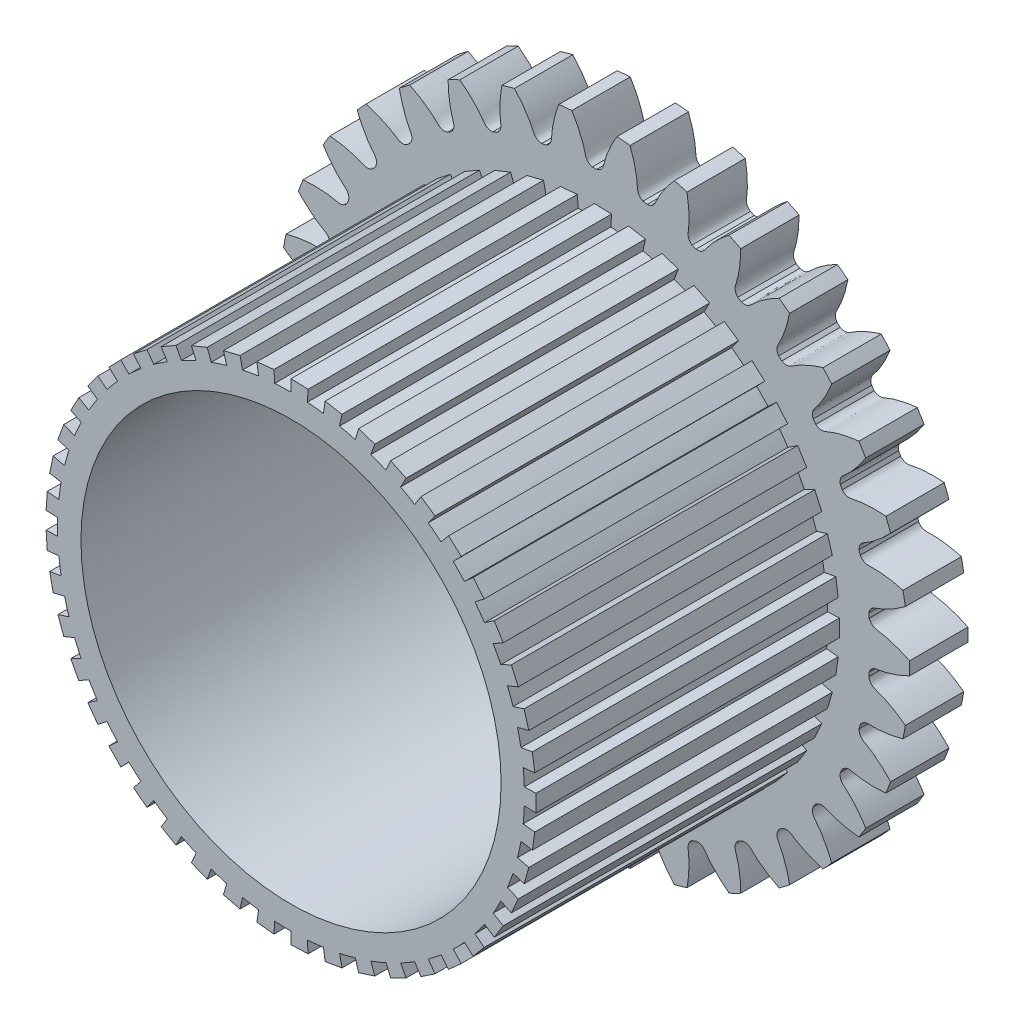
from build123d import *

# Parameters (mm, degrees)
SKETCH_1_R               = 27
EXTRUDE_1_DEPTH          = 5
CUT_EXTRUDE_1_DEPTH      = 39.509739028
PATTERN_CIRCULAR_1_COUNT = 34
SKETCH_4_R               = 12
SKETCH_4_R_2             = 4.5
SKETCH_4_R_3             = 3.25
CUT_EXTRUDE_2_DEPTH      = 3
CHAMFER_1_SIZE           = 2.5
SKETCH_6_R               = 3.25
CUT_EXTRUDE_3_DEPTH      = 39.252654908
SKETCH_7_R               = 18
EXTRUDE_2_DEPTH          = 26
SKETCH_8_R               = 4.5
CUT_EXTRUDE_4_DEPTH      = 2.5


with BuildPart() as part:
    # 草图1 → 凸台-拉伸1 (new body)
    with BuildSketch(Plane.XY):
        Circle(SKETCH_1_R)
    extrude(amount=EXTRUDE_1_DEPTH)

    # 草图2 → 切除-拉伸1 (cut, through all)
    with BuildSketch(Plane.XY):
        with BuildLine():
            ThreePointArc((0.183171175, 23.624289901), (0, 23.625), (-0.183171175, 23.624289901))
            add(Edge.make_bspline(
                [(-0.183171175, 23.624289901), (-0.716587806, 23.775112896), (-0.763410395, 24.188787315), (-0.879946356, 24.623629896), (-0.912930358, 24.738245821), (-0.951084244, 24.861314333), (-0.99469329, 24.992699977), (-1.044123655, 25.132221413), (-1.099711127, 25.279697341), (-1.161793992, 25.434932943), (-1.230702926, 25.597724076), (-1.306763614, 25.76785621), (-1.390295632, 25.945104927), (-1.481612426, 26.129235971), (-1.581020975, 26.320005435), (-1.688821555, 26.51715992), (-1.805307471, 26.720436707), (-1.930764813, 26.929563939), (-2.065472203, 27.144260803), (-2.209700557, 27.364237722), (-2.36371284, 27.589196551), (-2.527763841, 27.818830783), (-2.702099938, 28.052825758), (-2.886958877, 28.290858874), (-3.082569553, 28.532599812), (-3.289151799, 28.777710761), (-3.506916179, 29.025846649), (-3.73606378, 29.276655378), (-3.97678604, 29.52977807), (-4.229264468, 29.784849315), (-4.586391615, 30.131497572), (-4.865591808, 30.386500811), (-5.057363345, 30.554916542)],
                knots=[0, 0, 0, 0, 0.13072362, 0.143503881, 0.157401081, 0.17241522, 0.188546299, 0.205794316, 0.224159273, 0.243641169, 0.264240005, 0.285955779, 0.308788493, 0.332738146, 0.357804738, 0.383988269, 0.411288739, 0.439706149, 0.469240498, 0.499891786, 0.531660014, 0.56454518, 0.598547286, 0.633666331, 0.669902315, 0.707255238, 0.745725101, 0.785311903, 0.826015644, 0.867836324, 0.910773943, 1, 1, 1, 1], degree=3))
            ThreePointArc((-5.057363345, 30.554916542), (0, 30.970628811), (5.057363345, 30.554916542))
            add(Edge.make_bspline(
                [(0.183171175, 23.624289901), (0.716587806, 23.775112896), (0.763410395, 24.188787315), (0.879946356, 24.623629896), (0.912930358, 24.738245821), (0.951084244, 24.861314333), (0.99469329, 24.992699977), (1.044123655, 25.132221413), (1.099711127, 25.279697341), (1.161793992, 25.434932943), (1.230702926, 25.597724076), (1.306763614, 25.76785621), (1.390295632, 25.945104927), (1.481612426, 26.129235971), (1.581020975, 26.320005435), (1.688821555, 26.51715992), (1.805307471, 26.720436707), (1.930764813, 26.929563939), (2.065472203, 27.144260803), (2.209700557, 27.364237722), (2.36371284, 27.589196551), (2.527763841, 27.818830783), (2.702099938, 28.052825758), (2.886958877, 28.290858874), (3.082569553, 28.532599812), (3.289151799, 28.777710761), (3.506916179, 29.025846649), (3.73606378, 29.276655378), (3.97678604, 29.52977807), (4.229264468, 29.784849315), (4.586391615, 30.131497572), (4.865591808, 30.386500811), (5.057363345, 30.554916542)],
                knots=[0, 0, 0, 0, 0.13072362, 0.143503881, 0.157401081, 0.17241522, 0.188546299, 0.205794316, 0.224159273, 0.243641169, 0.264240005, 0.285955779, 0.308788493, 0.332738146, 0.357804738, 0.383988269, 0.411288739, 0.439706149, 0.469240498, 0.499891786, 0.531660014, 0.56454518, 0.598547286, 0.633666331, 0.669902315, 0.707255238, 0.745725101, 0.785311903, 0.826015644, 0.867836324, 0.910773943, 1, 1, 1, 1], degree=3))
        make_face()
    cut_extrude_1 = extrude(amount=CUT_EXTRUDE_1_DEPTH, mode=Mode.SUBTRACT)

    # 阵列(圆周)1: 切除-拉伸1 ×34 about axis
    pattern_circular_1_axis = Axis((0, 0, -1.5), (0, 0, 1))
    for i in range(1, PATTERN_CIRCULAR_1_COUNT):
        add(cut_extrude_1.rotate(pattern_circular_1_axis, i * 360 / PATTERN_CIRCULAR_1_COUNT), mode=Mode.SUBTRACT)

    # 草图4 → 切除-拉伸2 (cut)
    # profile 1 of 2: a face of its own
    with BuildSketch(Plane.XY.offset(5)):
        Circle(SKETCH_4_R)
        Circle(SKETCH_4_R_2, mode=Mode.SUBTRACT)
    # profile 2 of 2: a face of its own
    with BuildSketch(Plane.XY.offset(5)):
        Circle(SKETCH_4_R_3)
    extrude(amount=-CUT_EXTRUDE_2_DEPTH, mode=Mode.SUBTRACT)

    # 倒角1
    chamfer_1_edges = [part.edges().sort_by_distance(p)[0] for p in [
        (-12, 0, 5),
    ]]
    chamfer(chamfer_1_edges, length=CHAMFER_1_SIZE)

    # 草图6 → 切除-拉伸3 (cut, through all)
    with BuildSketch(Plane.XY.offset(2)):
        Circle(SKETCH_6_R)
    extrude(amount=-CUT_EXTRUDE_3_DEPTH, mode=Mode.SUBTRACT)

    # 草图7 → 凸台-拉伸2 (add)
    with BuildSketch(Plane.XY.offset(5)):
        with BuildLine():
            ThreePointArc((2.783462019, 19.805361375), (2.090569265, 19.890437907), (1.395129475, 19.951281005))
            Line((1.395129475, 19.951281005), (1.464885949, 20.948845055))
            Line((1.464885949, 20.948845055), (0, 21))
            Line((0, 21), (0, 20))
            ThreePointArc((0, 20), (-0.697989934, 19.98781654), (-1.395129475, 19.951281005))
            Line((-1.395129475, 19.951281005), (-1.464885949, 20.948845055))
            Line((-1.464885949, 20.948845055), (-2.92263512, 20.795629444))
            Line((-2.92263512, 20.795629444), (-2.783462019, 19.805361375))
            ThreePointArc((-2.783462019, 19.805361375), (-3.472963553, 19.69615506), (-4.158233816, 19.562952015))
            Line((-4.158233816, 19.562952015), (-4.366145507, 20.541099615))
            Line((-4.366145507, 20.541099615), (-5.788384472, 20.186495615))
            Line((-5.788384472, 20.186495615), (-5.512747116, 19.225233919))
            ThreePointArc((-5.512747116, 19.225233919), (-6.180339887, 19.021130326), (-6.840402867, 18.793852416))
            Line((-6.840402867, 18.793852416), (-7.18242301, 19.733545037))
            Line((-7.18242301, 19.733545037), (-8.541469505, 19.18445461))
            Line((-8.541469505, 19.18445461), (-8.134732862, 18.270909153))
            ThreePointArc((-8.134732862, 18.270909153), (-8.767422936, 17.975880926), (-9.389431256, 17.658951857))
            Line((-9.389431256, 17.658951857), (-9.858902819, 18.54189945))
            Line((-9.858902819, 18.54189945), (-11.128304549, 17.809010019))
            Line((-11.128304549, 17.809010019), (-10.598385285, 16.960961923))
            ThreePointArc((-10.598385285, 16.960961923), (-11.183858069, 16.580751451), (-11.755705046, 16.180339887))
            Line((-11.755705046, 16.180339887), (-12.343490298, 16.989356882))
            Line((-12.343490298, 16.989356882), (-13.498539803, 16.086933305))
            Line((-13.498539803, 16.086933305), (-12.855752194, 15.320888862))
            ThreePointArc((-12.855752194, 15.320888862), (-13.382612127, 14.86289651), (-13.893167409, 14.386796007))
            Line((-13.893167409, 14.386796007), (-14.58782578, 15.106135807))
            Line((-14.58782578, 15.106135807), (-15.606041335, 14.051742734))
            Line((-15.606041335, 14.051742734), (-14.86289651, 13.382612127))
            ThreePointArc((-14.86289651, 13.382612127), (-15.320888862, 12.855752194), (-15.760215072, 12.313229507))
            Line((-15.760215072, 12.313229507), (-16.548225826, 12.928890982))
            Line((-16.548225826, 12.928890982), (-17.409789024, 11.743050973))
            Line((-17.409789024, 11.743050973), (-16.580751451, 11.183858069))
            ThreePointArc((-16.580751451, 11.183858069), (-16.960961923, 10.598385285), (-17.320508076, 10))
            Line((-17.320508076, 10), (-18.186533479, 10.5))
            Line((-18.186533479, 10.5), (-18.874674972, 9.205794083))
            Line((-18.874674972, 9.205794083), (-17.975880926, 8.767422936))
            ThreePointArc((-17.975880926, 8.767422936), (-18.270909153, 8.134732862), (-18.543677091, 7.492131868))
            Line((-18.543677091, 7.492131868), (-19.470860946, 7.866738462))
            Line((-19.470860946, 7.866738462), (-19.972186842, 6.489356882))
            Line((-19.972186842, 6.489356882), (-19.021130326, 6.180339887))
            ThreePointArc((-19.021130326, 6.180339887), (-19.225233919, 5.512747116), (-19.405914526, 4.838437912))
            Line((-19.405914526, 4.838437912), (-20.376210252, 5.080359808))
            Line((-20.376210252, 5.080359808), (-20.680962813, 3.646611731))
            Line((-20.680962813, 3.646611731), (-19.69615506, 3.472963553))
            ThreePointArc((-19.69615506, 3.472963553), (-19.805361375, 2.783462019), (-19.890437907, 2.090569265))
            Line((-19.890437907, 2.090569265), (-20.884959803, 2.195097729))
            Line((-20.884959803, 2.195097729), (-20.987207367, 0.732889431))
            Line((-20.987207367, 0.732889431), (-19.98781654, 0.697989934))
            ThreePointArc((-19.98781654, 0.697989934), (-20, 0), (-19.98781654, -0.697989934))
            Line((-19.98781654, -0.697989934), (-20.987207367, -0.732889431))
            Line((-20.987207367, -0.732889431), (-20.884959803, -2.195097729))
            Line((-20.884959803, -2.195097729), (-19.890437907, -2.090569265))
            ThreePointArc((-19.890437907, -2.090569265), (-19.805361375, -2.783462019), (-19.69615506, -3.472963553))
            Line((-19.69615506, -3.472963553), (-20.680962813, -3.646611731))
            Line((-20.680962813, -3.646611731), (-20.376210252, -5.080359808))
            Line((-20.376210252, -5.080359808), (-19.405914526, -4.838437912))
            ThreePointArc((-19.405914526, -4.838437912), (-19.225233919, -5.512747116), (-19.021130326, -6.180339887))
            Line((-19.021130326, -6.180339887), (-19.972186842, -6.489356882))
            Line((-19.972186842, -6.489356882), (-19.470860946, -7.866738462))
            Line((-19.470860946, -7.866738462), (-18.543677091, -7.492131868))
            ThreePointArc((-18.543677091, -7.492131868), (-18.270909153, -8.134732862), (-17.975880926, -8.767422936))
            Line((-17.975880926, -8.767422936), (-18.874674972, -9.205794083))
            Line((-18.874674972, -9.205794083), (-18.186533479, -10.5))
            Line((-18.186533479, -10.5), (-17.320508076, -10))
            ThreePointArc((-17.320508076, -10), (-16.960961923, -10.598385285), (-16.580751451, -11.183858069))
            Line((-16.580751451, -11.183858069), (-17.409789024, -11.743050973))
            Line((-17.409789024, -11.743050973), (-16.548225826, -12.928890982))
            Line((-16.548225826, -12.928890982), (-15.760215072, -12.313229507))
            ThreePointArc((-15.760215072, -12.313229507), (-15.320888862, -12.855752194), (-14.86289651, -13.382612127))
            Line((-14.86289651, -13.382612127), (-15.606041335, -14.051742734))
            Line((-15.606041335, -14.051742734), (-14.58782578, -15.106135807))
            Line((-14.58782578, -15.106135807), (-13.893167409, -14.386796007))
            ThreePointArc((-13.893167409, -14.386796007), (-13.382612127, -14.86289651), (-12.855752194, -15.320888862))
            Line((-12.855752194, -15.320888862), (-13.498539803, -16.086933305))
            Line((-13.498539803, -16.086933305), (-12.343490298, -16.989356882))
            Line((-12.343490298, -16.989356882), (-11.755705046, -16.180339887))
            ThreePointArc((-11.755705046, -16.180339887), (-11.183858069, -16.580751451), (-10.598385285, -16.960961923))
            Line((-10.598385285, -16.960961923), (-11.128304549, -17.809010019))
            Line((-11.128304549, -17.809010019), (-9.858902819, -18.54189945))
            Line((-9.858902819, -18.54189945), (-9.389431256, -17.658951857))
            ThreePointArc((-9.389431256, -17.658951857), (-8.767422936, -17.975880926), (-8.134732862, -18.270909153))
            Line((-8.134732862, -18.270909153), (-8.541469505, -19.18445461))
            Line((-8.541469505, -19.18445461), (-7.18242301, -19.733545037))
            Line((-7.18242301, -19.733545037), (-6.840402867, -18.793852416))
            ThreePointArc((-6.840402867, -18.793852416), (-6.180339887, -19.021130326), (-5.512747116, -19.225233919))
            Line((-5.512747116, -19.225233919), (-5.788384472, -20.186495615))
            Line((-5.788384472, -20.186495615), (-4.366145507, -20.541099615))
            Line((-4.366145507, -20.541099615), (-4.158233816, -19.562952015))
            ThreePointArc((-4.158233816, -19.562952015), (-3.472963553, -19.69615506), (-2.783462019, -19.805361375))
            Line((-2.783462019, -19.805361375), (-2.92263512, -20.795629444))
            Line((-2.92263512, -20.795629444), (-1.464885949, -20.948845055))
            Line((-1.464885949, -20.948845055), (-1.395129475, -19.951281005))
            ThreePointArc((-1.395129475, -19.951281005), (-0.697989934, -19.98781654), (0, -20))
            Line((0, -20), (0, -21))
            Line((0, -21), (1.464885949, -20.948845055))
            Line((1.464885949, -20.948845055), (1.395129475, -19.951281005))
            ThreePointArc((1.395129475, -19.951281005), (2.090569265, -19.890437907), (2.783462019, -19.805361375))
            Line((2.783462019, -19.805361375), (2.92263512, -20.795629444))
            Line((2.92263512, -20.795629444), (4.366145507, -20.541099615))
            Line((4.366145507, -20.541099615), (4.158233816, -19.562952015))
            ThreePointArc((4.158233816, -19.562952015), (4.838437912, -19.405914526), (5.512747116, -19.225233919))
            Line((5.512747116, -19.225233919), (5.788384472, -20.186495615))
            Line((5.788384472, -20.186495615), (7.18242301, -19.733545037))
            Line((7.18242301, -19.733545037), (6.840402867, -18.793852416))
            ThreePointArc((6.840402867, -18.793852416), (7.492131868, -18.543677091), (8.134732862, -18.270909153))
            Line((8.134732862, -18.270909153), (8.541469505, -19.18445461))
            Line((8.541469505, -19.18445461), (9.858902819, -18.54189945))
            Line((9.858902819, -18.54189945), (9.389431256, -17.658951857))
            ThreePointArc((9.389431256, -17.658951857), (10, -17.320508076), (10.598385285, -16.960961923))
            Line((10.598385285, -16.960961923), (11.128304549, -17.809010019))
            Line((11.128304549, -17.809010019), (12.343490298, -16.989356882))
            Line((12.343490298, -16.989356882), (11.755705046, -16.180339887))
            ThreePointArc((11.755705046, -16.180339887), (12.313229507, -15.760215072), (12.855752194, -15.320888862))
            Line((12.855752194, -15.320888862), (13.498539803, -16.086933305))
            Line((13.498539803, -16.086933305), (14.58782578, -15.106135807))
            Line((14.58782578, -15.106135807), (13.893167409, -14.386796007))
            ThreePointArc((13.893167409, -14.386796007), (14.386796007, -13.893167409), (14.86289651, -13.382612127))
            Line((14.86289651, -13.382612127), (15.606041335, -14.051742734))
            Line((15.606041335, -14.051742734), (16.548225826, -12.928890982))
            Line((16.548225826, -12.928890982), (15.760215072, -12.313229507))
            ThreePointArc((15.760215072, -12.313229507), (16.180339887, -11.755705046), (16.580751451, -11.183858069))
            Line((16.580751451, -11.183858069), (17.409789024, -11.743050973))
            Line((17.409789024, -11.743050973), (18.186533479, -10.5))
            Line((18.186533479, -10.5), (17.320508076, -10))
            ThreePointArc((17.320508076, -10), (17.658951857, -9.389431256), (17.975880926, -8.767422936))
            Line((17.975880926, -8.767422936), (18.874674972, -9.205794083))
            Line((18.874674972, -9.205794083), (19.470860946, -7.866738462))
            Line((19.470860946, -7.866738462), (18.543677091, -7.492131868))
            ThreePointArc((18.543677091, -7.492131868), (18.793852416, -6.840402867), (19.021130326, -6.180339887))
            Line((19.021130326, -6.180339887), (19.972186842, -6.489356882))
            Line((19.972186842, -6.489356882), (20.376210252, -5.080359808))
            Line((20.376210252, -5.080359808), (19.405914526, -4.838437912))
            ThreePointArc((19.405914526, -4.838437912), (19.562952015, -4.158233816), (19.69615506, -3.472963553))
            Line((19.69615506, -3.472963553), (20.680962813, -3.646611731))
            Line((20.680962813, -3.646611731), (20.884959803, -2.195097729))
            Line((20.884959803, -2.195097729), (19.890437907, -2.090569265))
            ThreePointArc((19.890437907, -2.090569265), (19.951281005, -1.395129475), (19.98781654, -0.697989934))
            Line((19.98781654, -0.697989934), (20.987207367, -0.732889431))
            Line((20.987207367, -0.732889431), (20.987207367, 0.732889431))
            Line((20.987207367, 0.732889431), (19.98781654, 0.697989934))
            ThreePointArc((19.98781654, 0.697989934), (19.951281005, 1.395129475), (19.890437907, 2.090569265))
            Line((19.890437907, 2.090569265), (20.884959803, 2.195097729))
            Line((20.884959803, 2.195097729), (20.680962813, 3.646611731))
            Line((20.680962813, 3.646611731), (19.69615506, 3.472963553))
            ThreePointArc((19.69615506, 3.472963553), (19.562952015, 4.158233816), (19.405914526, 4.838437912))
            Line((19.405914526, 4.838437912), (20.376210252, 5.080359808))
            Line((20.376210252, 5.080359808), (19.972186842, 6.489356882))
            Line((19.972186842, 6.489356882), (19.021130326, 6.180339887))
            ThreePointArc((19.021130326, 6.180339887), (18.793852416, 6.840402867), (18.543677091, 7.492131868))
            Line((18.543677091, 7.492131868), (19.470860946, 7.866738462))
            Line((19.470860946, 7.866738462), (18.874674972, 9.205794083))
            Line((18.874674972, 9.205794083), (17.975880926, 8.767422936))
            ThreePointArc((17.975880926, 8.767422936), (17.658951857, 9.389431256), (17.320508076, 10))
            Line((17.320508076, 10), (18.186533479, 10.5))
            Line((18.186533479, 10.5), (17.409789024, 11.743050973))
            Line((17.409789024, 11.743050973), (16.580751451, 11.183858069))
            ThreePointArc((16.580751451, 11.183858069), (16.180339887, 11.755705046), (15.760215072, 12.313229507))
            Line((15.760215072, 12.313229507), (16.548225826, 12.928890982))
            Line((16.548225826, 12.928890982), (15.606041335, 14.051742734))
            Line((15.606041335, 14.051742734), (14.86289651, 13.382612127))
            ThreePointArc((14.86289651, 13.382612127), (14.386796007, 13.893167409), (13.893167409, 14.386796007))
            Line((13.893167409, 14.386796007), (14.58782578, 15.106135807))
            Line((14.58782578, 15.106135807), (13.498539803, 16.086933305))
            Line((13.498539803, 16.086933305), (12.855752194, 15.320888862))
            ThreePointArc((12.855752194, 15.320888862), (12.313229507, 15.760215072), (11.755705046, 16.180339887))
            Line((11.755705046, 16.180339887), (12.343490298, 16.989356882))
            Line((12.343490298, 16.989356882), (11.128304549, 17.809010019))
            Line((11.128304549, 17.809010019), (10.598385285, 16.960961923))
            ThreePointArc((10.598385285, 16.960961923), (10, 17.320508076), (9.389431256, 17.658951857))
            Line((9.389431256, 17.658951857), (9.858902819, 18.54189945))
            Line((9.858902819, 18.54189945), (8.541469505, 19.18445461))
            Line((8.541469505, 19.18445461), (8.134732862, 18.270909153))
            ThreePointArc((8.134732862, 18.270909153), (7.492131868, 18.543677091), (6.840402867, 18.793852416))
            Line((6.840402867, 18.793852416), (7.18242301, 19.733545037))
            Line((7.18242301, 19.733545037), (5.788384472, 20.186495615))
            Line((5.788384472, 20.186495615), (5.512747116, 19.225233919))
            ThreePointArc((5.512747116, 19.225233919), (4.838437912, 19.405914526), (4.158233816, 19.562952015))
            Line((4.158233816, 19.562952015), (4.366145507, 20.541099615))
            Line((4.366145507, 20.541099615), (2.92263512, 20.795629444))
            Line((2.92263512, 20.795629444), (2.783462019, 19.805361375))
        make_face()
        Circle(SKETCH_7_R, mode=Mode.SUBTRACT)
    extrude(amount=EXTRUDE_2_DEPTH)

    # 草图8 → 切除-拉伸4 (cut)
    with BuildSketch(Plane.XY.offset(5)):
        Circle(SKETCH_8_R)
    extrude(amount=-CUT_EXTRUDE_4_DEPTH, mode=Mode.SUBTRACT)


solid = part.part
